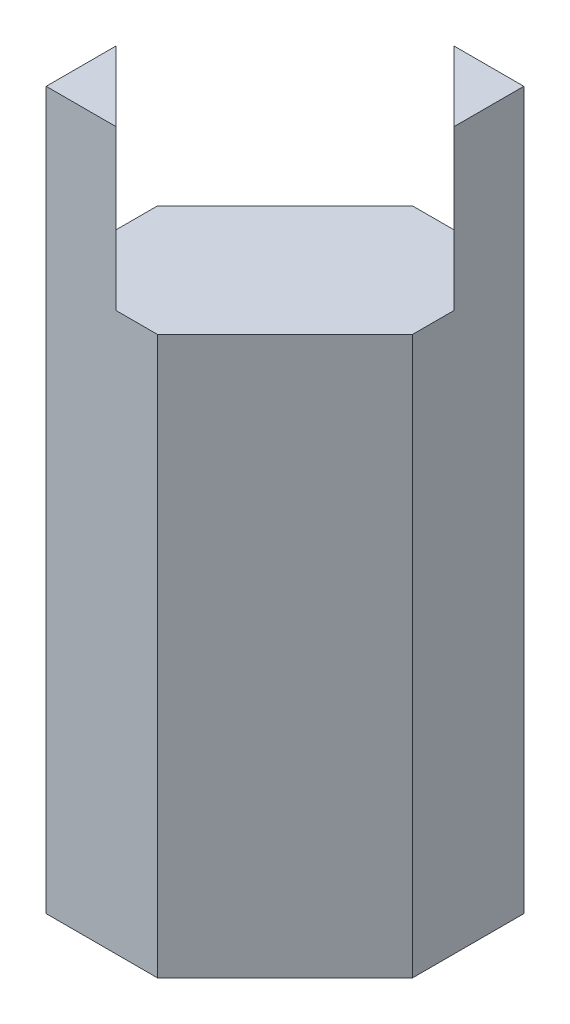
from build123d import *

# Parameters (mm, degrees)
SKETCH1_W           = 19.05
SKETCH1_H           = 19.05
BOSS_EXTRUDE1_DEPTH = 44.45
BOSS_EXTRUDE2_DEPTH = 12.7
CUT_EXTRUDE1_DEPTH  = 47.446245812


with BuildPart() as part:
    # Sketch1 → Boss-Extrude1 (new body)
    with BuildSketch(Plane(origin=(0, 0, 0), x_dir=(1, 0, 0), z_dir=(0, 1, 0))):
        Rectangle(SKETCH1_W, SKETCH1_H)
    extrude(amount=BOSS_EXTRUDE1_DEPTH)

    # Sketch2 → Boss-Extrude2 (add)
    with BuildSketch(Plane(origin=(0, 44.45, 0), x_dir=(1, 0, 0), z_dir=(0, 1, 0))):
        Polygon((-9.525, -9.525), (-3.957241205, -9.525), (-9.525, -3.957241205), align=None)
    boss_extrude2 = extrude(amount=BOSS_EXTRUDE2_DEPTH)

    # Mirror1: Boss-Extrude2 across plane
    add(boss_extrude2.mirror(Plane(origin=(0, 0, 0), x_dir=(0.7071067811865478, 0, 0.7071067811865472), z_dir=(-0.7071067811865475, 0, 0.7071067811865477))))

    # Sketch3 → Cut-Extrude1 (cut, through all)
    with BuildSketch(Plane(origin=(0, 44.45, 0), x_dir=(1, 0, 0), z_dir=(0, 1, 0))):
        Polygon((9.525, -9.525), (-0.635, -9.525), (9.525, 0.635), align=None)
    cut_extrude1 = extrude(amount=-CUT_EXTRUDE1_DEPTH, mode=Mode.SUBTRACT)

    # Mirror2: Cut-Extrude1 across plane
    add(cut_extrude1.mirror(Plane(origin=(0, 0, 0), x_dir=(-0.7071067811865478, 0, 0.7071067811865472), z_dir=(-0.7071067811865475, 0, -0.7071067811865477))), mode=Mode.SUBTRACT)


solid = part.part
